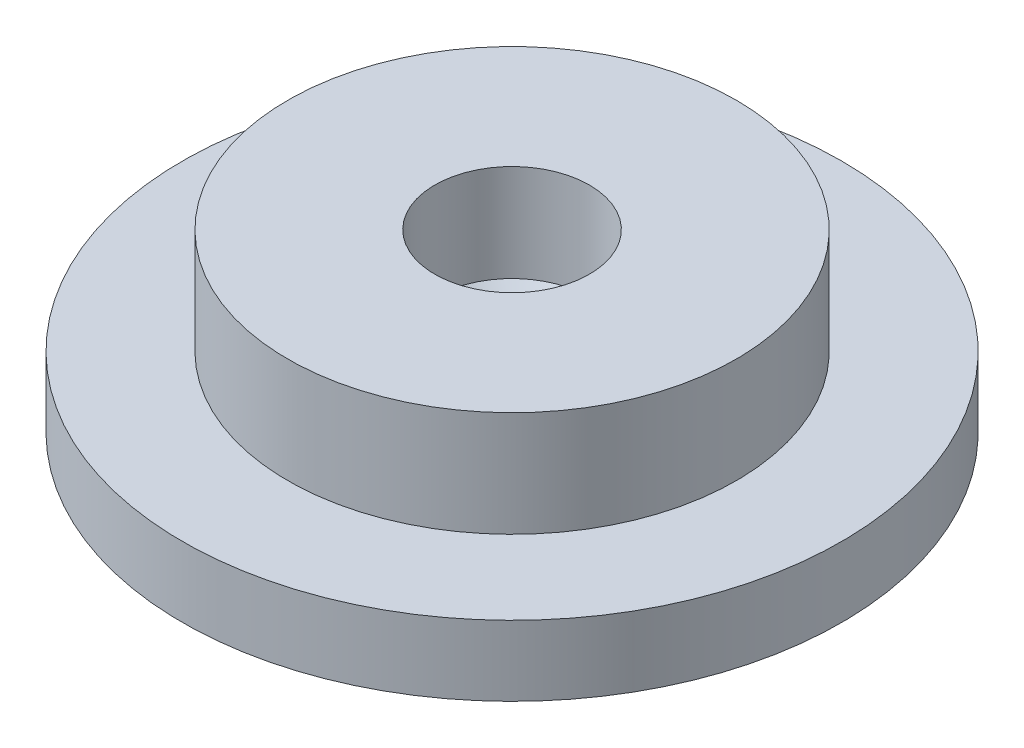
from build123d import *


with BuildPart() as part:
    # Sketch3 → Revolve1 (revolve)
    with BuildSketch(Plane(origin=(0, 0, 0), x_dir=(0, 0, -1), z_dir=(1, 0, 0))):
        with BuildLine():
            Line((93.88, 9.355328201), (63.88, 9.355328201))
            Line((63.88, 9.355328201), (63.88, 39.355328201))
            Line((63.88, 39.355328201), (22.025, 39.355328201))
            Line((22.025, 39.355328201), (22.025, 11.715328201))
            Line((22.025, 11.715328201), (14.665, 4.355328201))
            Line((14.665, 4.355328201), (14.665, -0.644671799))
            Line((14.665, -0.644671799), (19.665, -0.644671799))
            ThreePointArc((19.665, -0.644671799), (40.232841234, 6.235782209), (53.85, -10.644671799))
            Line((53.85, -10.644671799), (93.88, -10.644671799))
            Line((93.88, -10.644671799), (93.88, 9.355328201))
        make_face()
    revolve(axis=Axis((0, 0, 0), (0, 1, 0)))


solid = part.part
